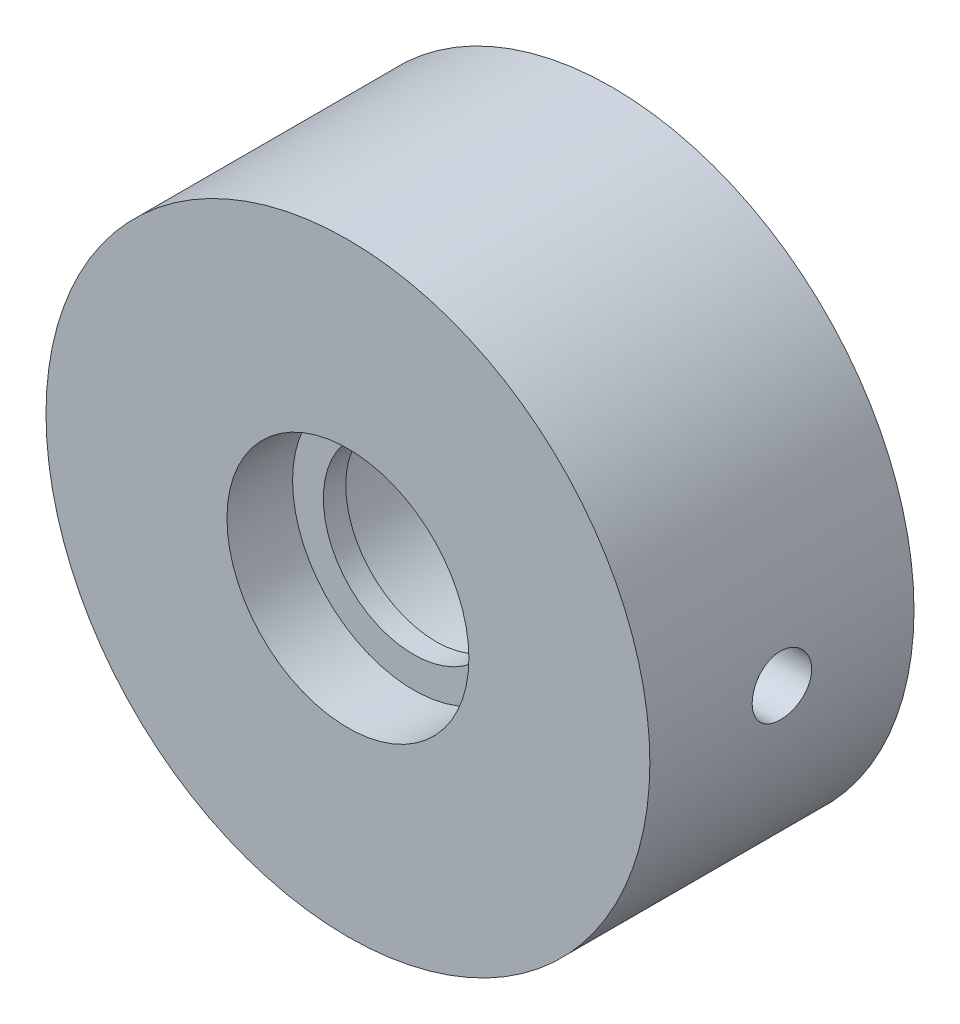
from build123d import *

# Parameters (mm, degrees)
SKETCH1_R           = 29.95
BOSS_EXTRUDE1_DEPTH = 12.7
SKETCH3_R           = 12
CUT_EXTRUDE2_DEPTH  = 45.218717756
SKETCH4_R           = 12
BOSS_EXTRUDE2_DEPTH = 2.2225
SKETCH5_R           = 8.95
CUT_EXTRUDE3_DEPTH  = 43.852874193
BOSS_EXTRUDE6_START = 13.5
SKETCH11_R          = 29.95
SKETCH11_R_2        = 12
BOSS_EXTRUDE6_DEPTH = 13.5
SKETCH12_R          = 2.95
CUT_EXTRUDE4_DEPTH  = 9


with BuildPart() as part:
    # Sketch1 → Boss-Extrude1 (new body)
    with BuildSketch(Plane.XY):
        Circle(SKETCH1_R)
    extrude(amount=BOSS_EXTRUDE1_DEPTH)

    # Sketch3 → Cut-Extrude2 (cut, through all)
    with BuildSketch(Plane(origin=(0, 0, 0), x_dir=(-1, 0, 0), z_dir=(0, 0, -1))):
        Circle(SKETCH3_R)
    extrude(amount=-CUT_EXTRUDE2_DEPTH, mode=Mode.SUBTRACT)

    # Sketch4 → Boss-Extrude2 (add)
    with BuildSketch(Plane(origin=(0, 0, 3.96875), x_dir=(-1, 0, 0), z_dir=(0, 0, -1))):
        Circle(SKETCH4_R)
    extrude(amount=-BOSS_EXTRUDE2_DEPTH)

    # Sketch5 → Cut-Extrude3 (cut, through all)
    with BuildSketch(Plane.XY.offset(6.19125)):
        Circle(SKETCH5_R)
    extrude(amount=-CUT_EXTRUDE3_DEPTH, mode=Mode.SUBTRACT)

    # Sketch11 → Boss-Extrude6 (add)
    with BuildSketch(Plane(origin=(0, 0, 0), x_dir=(-1, 0, 0), z_dir=(0, 0, -1)).offset(BOSS_EXTRUDE6_START)):
        Circle(SKETCH11_R)
        Circle(SKETCH11_R_2, mode=Mode.SUBTRACT)
    extrude(amount=-BOSS_EXTRUDE6_DEPTH)

    # Sketch12 → Cut-Extrude4 (cut)
    with BuildSketch(Plane(origin=(-29.95, 0, 6.19125), x_dir=(0, 0, 1), z_dir=(-1, 0, 0))):
        with Locations((-6.59125, 0)):
            Circle(SKETCH12_R)
    cut_extrude4 = extrude(amount=-CUT_EXTRUDE4_DEPTH, mode=Mode.SUBTRACT)

    # Mirror2: Cut-Extrude4 across plane
    add(cut_extrude4.mirror(Plane(origin=(0, 0, 0), x_dir=(0, 0, 1), z_dir=(1, 0, 0))), mode=Mode.SUBTRACT)


solid = part.part
